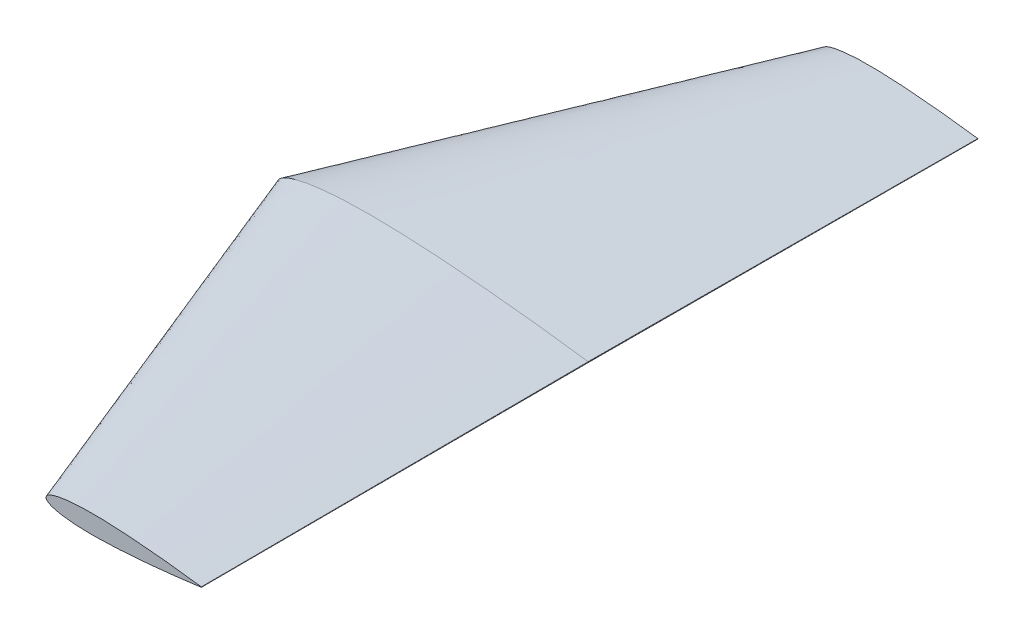
from build123d import *


with BuildPart() as part:
    # Sketch1 → Loft1 section 0
    with BuildSketch(Plane.XY):
        with BuildLine():
            ThreePointArc((80.032877443, 0.100841426), (80.106065641, 0), (80.032877443, -0.100841426))
            add(Edge.make_bspline(
                [(80.032877443, 0.100841426), (80.017297817, 0.103029758), (79.955035306, 0.111775221), (79.706543392, 0.146529184), (79.334558291, 0.198478896), (78.839846708, 0.26670356), (78.332224081, 0.336495609), (77.735087562, 0.417819911), (77.049852412, 0.510149739), (76.278141395, 0.613090269), (75.421748163, 0.725902447), (74.48266814, 0.848056361), (73.463075127, 0.978571492), (71.949893131, 1.169556443), (70.337643406, 1.36775791), (68.630056308, 1.572190313), (67.24726559, 1.73454522), (65.80082892, 1.900734947), (64.294206827, 2.070335071), (62.730870795, 2.242128962), (61.114521626, 2.415655216), (59.44887106, 2.589673784), (57.737845374, 2.763862188), (55.985419711, 2.936877242), (54.195714517, 3.108175551), (52.372885813, 3.276567372), (50.52118581, 3.441502168), (48.644950565, 3.601616447), (46.748552452, 3.756194036), (44.836444573, 3.904247778), (42.913068342, 4.044589169), (40.982943776, 4.176338003), (39.050576473, 4.298441893), (36.482978361, 4.446473629), (33.926943847, 4.571359479), (30.771091462, 4.692882014), (28.286625998, 4.761316478), (25.837577063, 4.796898753), (24.047747622, 4.80627525), (22.295199071, 4.797986201), (20.584033031, 4.771658928), (18.918259312, 4.726497794), (17.30173127, 4.662702647), (15.738220861, 4.579815103), (14.231368134, 4.478067485), (12.784721389, 4.357481008), (11.401643992, 4.218274839), (10.085349569, 4.060977052), (8.838872692, 3.88622702), (7.665149765, 3.69435049), (6.56687074, 3.486306432), (5.546563287, 3.262877122), (4.606611947, 3.024819962), (3.749093721, 2.77320141), (2.975899435, 2.50885709), (2.288677967, 2.232699988), (1.688789705, 1.945526765), (1.177377513, 1.647935303), (0.755036909, 1.340430078), (0.42258397, 1.02250526), (0.180820416, 0.693260222), (0.033005798, 0.351085652), (-0.016088408, 0), (0.033005798, -0.351085652), (0.180820416, -0.693260222), (0.42258397, -1.02250526), (0.755036909, -1.340430078), (1.177377513, -1.647935303), (1.688789705, -1.945526765), (2.288677967, -2.232699988), (2.975899435, -2.50885709), (3.749093721, -2.77320141), (4.606611947, -3.024819962), (5.546563287, -3.262877122), (6.56687074, -3.486306432), (7.665149765, -3.69435049), (8.838872692, -3.88622702), (10.085349569, -4.060977052), (11.401643992, -4.218274839), (12.784721389, -4.357481008), (14.231368134, -4.478067485), (15.738220861, -4.579815103), (17.30173127, -4.662702647), (18.918259312, -4.726497794), (20.584033031, -4.771658928), (22.295199071, -4.797986201), (24.047747622, -4.80627525), (25.837577063, -4.796898753), (28.286625998, -4.761316478), (31.409387505, -4.675300185), (34.564818798, -4.542030046), (37.120439258, -4.409721599), (39.050576473, -4.298441893), (40.982943776, -4.176338003), (42.913068342, -4.044589169), (44.836444573, -3.904247778), (46.748552452, -3.756194036), (48.644950565, -3.601616447), (50.52118581, -3.441502168), (52.372885813, -3.276567372), (54.195714517, -3.108175551), (55.985419711, -2.936877242), (57.737845374, -2.763862188), (59.44887106, -2.589673784), (61.114521626, -2.415655216), (62.730870795, -2.242128962), (64.294206827, -2.070335071), (65.80082892, -1.900734947), (67.24726559, -1.73454522), (68.630056308, -1.572190313), (70.337643406, -1.36775791), (71.949893131, -1.169556443), (73.463075127, -0.978571492), (74.48266814, -0.848056361), (75.421748163, -0.725902447), (76.278141395, -0.613090269), (77.049852412, -0.510149739), (77.735087562, -0.417819911), (78.332224081, -0.336495609), (78.839846708, -0.26670356), (79.334558291, -0.198478896), (79.706543392, -0.146529184), (79.955035306, -0.111775221), (80.017297817, -0.103029758), (80.032877443, -0.100841426)],
                knots=[0, 0, 0, 0, 0.000289201, 0.001155766, 0.004612322, 0.007193518, 0.010335793, 0.014031397, 0.018271612, 0.023045847, 0.028342901, 0.03415012, 0.04045376, 0.04723833, 0.062186613, 0.070313724, 0.078851908, 0.087780126, 0.097077521, 0.106722049, 0.116690868, 0.126960505, 0.137507218, 0.148306055, 0.159330765, 0.17055649, 0.181956531, 0.193504043, 0.205171367, 0.2169323, 0.228758169, 0.2406214, 0.252494936, 0.264350287, 0.287897994, 0.299535854, 0.322404759, 0.333584032, 0.344559266, 0.35530596, 0.365799778, 0.37601757, 0.3859373, 0.395537659, 0.404797976, 0.413698812, 0.422221441, 0.430349273, 0.438066019, 0.445356904, 0.452209372, 0.458611567, 0.464554044, 0.47002985, 0.475034902, 0.479569141, 0.483636857, 0.487250263, 0.490431338, 0.493218828, 0.495674086, 0.497891368, 0.5, 0.502108632, 0.504325914, 0.506781172, 0.509568662, 0.512749737, 0.516363143, 0.520430859, 0.524965098, 0.52997015, 0.535445956, 0.541388433, 0.547790628, 0.554643096, 0.561933981, 0.569650727, 0.577778559, 0.586301188, 0.595202024, 0.604462341, 0.6140627, 0.62398243, 0.634200222, 0.64469404, 0.655440734, 0.666415968, 0.677595241, 0.700464146, 0.723839427, 0.735649713, 0.747505064, 0.7593786, 0.771241831, 0.7830677, 0.794828633, 0.806495957, 0.818043469, 0.82944351, 0.840669235, 0.851693945, 0.862492782, 0.873039495, 0.883309132, 0.893277951, 0.902922479, 0.912219874, 0.921148092, 0.929686276, 0.937813387, 0.95276167, 0.95954624, 0.96584988, 0.971657099, 0.976954153, 0.981728388, 0.985968603, 0.989664207, 0.992806482, 0.995387678, 0.998844234, 0.999710799, 1, 1, 1, 1], degree=3))
        make_face()
    # Sketch2 → Loft1 section 1
    with BuildSketch(Plane.XY.offset(100)):
        with BuildLine():
            ThreePointArc((80.399999989, 0.050399999), (80.450399989, 0), (80.399999989, -0.050399999))
            add(Edge.make_bspline(
                [(80.399999989, 0.050399999), (80.392213377, 0.051493716), (80.36109491, 0.055864651), (80.236899995, 0.073234494), (80.050983852, 0.099198679), (79.803729677, 0.133296998), (79.550022632, 0.168178686), (79.251577028, 0.208824133), (78.909100204, 0.254970082), (78.52340321, 0.306419202), (78.095382502, 0.362802119), (77.626035383, 0.423853985), (77.116448307, 0.489084742), (76.360168125, 0.584537988), (75.554374427, 0.68359801), (74.700931627, 0.78577222), (74.009820301, 0.866916325), (73.286899072, 0.949977052), (72.533897495, 1.034742277), (71.752550597, 1.120603935), (70.94470802, 1.207331419), (70.112224871, 1.294304958), (69.257063483, 1.381363381), (68.381210609, 1.46783537), (67.486725628, 1.553449338), (66.575685695, 1.63761066), (65.650216044, 1.72004418), (64.712483811, 1.800068431), (63.764674285, 1.877325474), (62.809013104, 1.951321934), (61.847720061, 2.021463803), (60.883054236, 2.087311158), (59.917267505, 2.148338022), (58.633995848, 2.222323483), (57.356503615, 2.284740756), (55.779225653, 2.345477062), (54.537503244, 2.379680237), (53.313481825, 2.397464066), (52.418934746, 2.402150388), (51.543020454, 2.398007567), (50.687788917, 2.384849338), (49.855244218, 2.362278047), (49.047312241, 2.330393577), (48.26587819, 2.288966831), (47.512761343, 2.238113922), (46.78973512, 2.177845452), (46.098480514, 2.108270962), (45.440603676, 2.029654378), (44.817621271, 1.942315256), (44.231000898, 1.846416404), (43.682086978, 1.742437109), (43.172142828, 1.630768347), (42.70236023, 1.511788666), (42.273777256, 1.386031073), (41.887338931, 1.253913211), (41.543869357, 1.115891384), (41.244048446, 0.97236376), (40.988447397, 0.823629156), (40.777363846, 0.669939707), (40.611205665, 0.511042602), (40.490373547, 0.346487711), (40.4164966, 0.175470711), (40.391959581, 0), (40.4164966, -0.175470711), (40.490373547, -0.346487711), (40.611205665, -0.511042602), (40.777363846, -0.669939707), (40.988447397, -0.823629156), (41.244048446, -0.97236376), (41.543869357, -1.115891384), (41.887338931, -1.253913211), (42.273777256, -1.386031074), (42.70236023, -1.511788666), (43.172142828, -1.630768347), (43.682086978, -1.742437109), (44.231000898, -1.846416404), (44.817621271, -1.942315256), (45.440603676, -2.029654378), (46.098480514, -2.108270962), (46.78973512, -2.177845452), (47.512761343, -2.238113922), (48.26587819, -2.288966831), (49.047312241, -2.330393577), (49.855244218, -2.362278047), (50.687788917, -2.384849338), (51.543020454, -2.398007567), (52.418934746, -2.402150388), (53.313481825, -2.397464066), (54.537503244, -2.379680237), (56.098242564, -2.336689759), (57.675310067, -2.270082064), (58.952595358, -2.203955017), (59.917267505, -2.148338022), (60.883054236, -2.087311158), (61.847720061, -2.021463803), (62.809013104, -1.951321934), (63.764674285, -1.877325474), (64.712483811, -1.800068431), (65.650216044, -1.72004418), (66.575685695, -1.63761066), (67.486725628, -1.553449338), (68.381210609, -1.46783537), (69.257063483, -1.381363381), (70.112224871, -1.294304958), (70.94470802, -1.207331419), (71.752550597, -1.120603935), (72.533897495, -1.034742277), (73.286899072, -0.949977052), (74.009820301, -0.866916325), (74.700931627, -0.78577222), (75.554374427, -0.68359801), (76.360168125, -0.584537988), (77.116448307, -0.489084742), (77.626035383, -0.423853985), (78.095382502, -0.362802119), (78.52340321, -0.306419202), (78.909100204, -0.254970082), (79.251577028, -0.208824133), (79.550022632, -0.168178686), (79.803729677, -0.133296998), (80.050983852, -0.099198679), (80.236899995, -0.073234494), (80.36109491, -0.055864651), (80.392213377, -0.051493716), (80.399999989, -0.050399999)],
                knots=[0, 0, 0, 0, 0.000289201, 0.001155766, 0.004612322, 0.007193518, 0.010335793, 0.014031397, 0.018271612, 0.023045847, 0.028342901, 0.03415012, 0.04045376, 0.04723833, 0.062186613, 0.070313724, 0.078851908, 0.087780126, 0.097077521, 0.106722049, 0.116690868, 0.126960505, 0.137507218, 0.148306055, 0.159330765, 0.17055649, 0.181956531, 0.193504043, 0.205171367, 0.2169323, 0.228758169, 0.2406214, 0.252494936, 0.264350287, 0.287897994, 0.299535854, 0.322404759, 0.333584032, 0.344559266, 0.35530596, 0.365799778, 0.37601757, 0.3859373, 0.395537659, 0.404797976, 0.413698812, 0.422221441, 0.430349273, 0.438066019, 0.445356904, 0.452209372, 0.458611567, 0.464554044, 0.47002985, 0.475034902, 0.479569141, 0.483636857, 0.487250263, 0.490431338, 0.493218828, 0.495674086, 0.497891368, 0.5, 0.502108632, 0.504325914, 0.506781172, 0.509568662, 0.512749737, 0.516363143, 0.520430859, 0.524965098, 0.52997015, 0.535445956, 0.541388433, 0.547790628, 0.554643096, 0.561933981, 0.569650727, 0.577778559, 0.586301188, 0.595202024, 0.604462341, 0.6140627, 0.62398243, 0.634200222, 0.64469404, 0.655440734, 0.666415968, 0.677595241, 0.700464146, 0.723839427, 0.735649713, 0.747505064, 0.7593786, 0.771241831, 0.7830677, 0.794828633, 0.806495957, 0.818043469, 0.82944351, 0.840669235, 0.851693945, 0.862492782, 0.873039495, 0.883309132, 0.893277951, 0.902922479, 0.912219874, 0.921148092, 0.929686276, 0.937813387, 0.95276167, 0.95954624, 0.96584988, 0.971657099, 0.976954153, 0.981728388, 0.985968603, 0.989664207, 0.992806482, 0.995387678, 0.998844234, 0.999710799, 1, 1, 1, 1], degree=3))
        make_face()
    loft1 = loft()

    # Mirror1: Loft1 across plane
    add(loft1.mirror(Plane(origin=(0, 0, 0), x_dir=(1, 0, 0), z_dir=(0, 0, -1))))


solid = part.part
